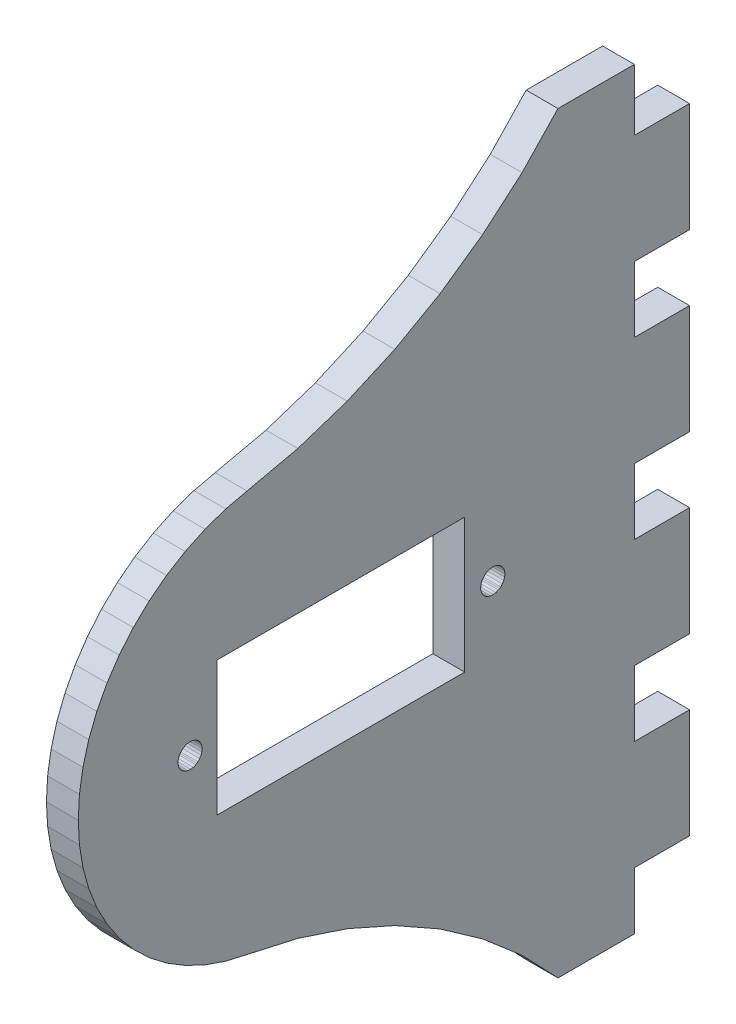
from build123d import *

# Parameters (mm, degrees)
SKETCH1_W           = 23.350747384
SKETCH1_H           = 12.661294137
BOSS_EXTRUDE1_DEPTH = 3.000000026


with BuildPart() as part:
    # Sketch1 → Boss-Extrude1 (new body)
    with BuildSketch(Plane(origin=(3.000000026, 0, 0), x_dir=(0, 0, -1), z_dir=(1, 0, 0))):
        Polygon((-22.126813087, 14.566896599), (-23.618608524, 13.137944419), (-24.948335068, 11.557064251), (-26.100618987, 9.84253814), (-27.062131736, 8.01419217), (-27.821758143, 6.093169819), (-28.370710455, 4.101685968), (-28.702640459, 2.062770048), (-28.813712936, 0), (-28.702640459, -2.062770048), (-28.370710455, -4.101685968), (-27.821758143, -6.093169819), (-27.062131736, -8.01419217), (-26.100618987, -9.84253814), (-24.948335068, -11.557064251), (-23.618608524, -13.137944419), (-22.126813087, -14.566896599), (-20.49020144, -15.827396878), (-18.727698375, -16.904867948), (-16.859690084, -17.786850182), (-14.907771901, -18.463145652), (-12.894519224, -18.925933141), (-8.109779278, -20.001272997), (-3.452964586, -21.538859081), (1.031382849, -23.52398457), (5.300370902, -25.937660881), (9.313167863, -28.756801315), (13.031389535, -31.954443363), (16.419475096, -35.5), (23.624659048, -35.5), (23.624659048, -30.096402), (28.824659048, -30.096402), (28.824659048, -19.796402), (23.624659048, -19.796402), (23.624659048, -13.596402), (28.824659048, -13.596402), (28.824659048, -3.296402), (23.624659048, -3.296402), (23.624659048, 2.903598), (28.824659048, 2.903598), (28.824659048, 13.203598), (23.624659048, 13.203598), (23.624659048, 19.403598), (28.824659048, 19.403598), (28.824659048, 29.703598), (23.624659048, 29.703598), (23.624659048, 35.5), (16.419475096, 35.5), (13.031389535, 31.954443363), (9.313167863, 28.756801315), (5.300370902, 25.937658948), (1.031382849, 23.523982637), (-3.452964586, 21.538857148), (-8.109779278, 20.001271064), (-12.894519224, 18.925931208), (-14.907771901, 18.463145652), (-16.859690084, 17.786850182), (-18.727698375, 16.904867948), (-20.49020144, 15.827396878), align=None)
        with Locations((-4.051542986, 0.207561969)):
            Rectangle(SKETCH1_W, SKETCH1_H, mode=Mode.SUBTRACT)
        Polygon((-18.804284818, 1.008610336), (-18.574960429, 1.099981108), (-18.331358358, 1.139917805), (-18.084864409, 1.12655338), (-17.8470055, 1.060512457), (-17.62890647, 0.944883242), (-17.530501424, 0.870078186), (-17.360738899, 0.690862086), (-17.233473065, 0.47934209), (-17.154650055, 0.245408558), (-17.127958174, 0), (-17.154650055, -0.245408558), (-17.233473065, -0.47934209), (-17.360738899, -0.690862086), (-17.530501424, -0.870078186), (-17.62890647, -0.944883242), (-17.734821506, -1.008610336), (-17.964143962, -1.099981108), (-18.207747966, -1.139917805), (-18.454241915, -1.12655338), (-18.692100824, -1.060512457), (-18.910199855, -0.944883242), (-19.098343977, -0.78507224), (-19.247733839, -0.588552231), (-19.351387179, -0.36451211), (-19.404453916, -0.123427815), (-19.411144284, 0), (-19.384456269, 0.245408558), (-19.30563326, 0.47934209), (-19.178367425, 0.690862086), (-19.0086049, 0.870078186), align=None, mode=Mode.SUBTRACT)
        Polygon((9.735517385, 1.008610336), (9.964840808, 1.099981108), (10.208444812, 1.139917805), (10.454937794, 1.12655338), (10.692795737, 1.060512457), (10.910895734, 0.944883242), (11.009299813, 0.870078186), (11.179063304, 0.690862086), (11.306330105, 0.47934209), (11.385151182, 0.245408558), (11.41184113, 0), (11.385151182, -0.245408558), (11.306330105, -0.47934209), (11.179063304, -0.690862086), (11.009299813, -0.870078186), (10.910895734, -0.944883242), (10.804980698, -1.008610336), (10.575657275, -1.099981108), (10.332054238, -1.139917805), (10.085560289, -1.12655338), (9.847702346, -1.060512457), (9.629602349, -0.944883242), (9.441458227, -0.78507224), (9.292067398, -0.588552231), (9.188415991, -0.36451211), (9.135349254, -0.123427815), (9.128656953, 0), (9.155346901, 0.245408558), (9.234167977, 0.47934209), (9.361435745, 0.690862086), (9.53119827, 0.870078186), align=None, mode=Mode.SUBTRACT)
    extrude(amount=-BOSS_EXTRUDE1_DEPTH)


solid = part.part
